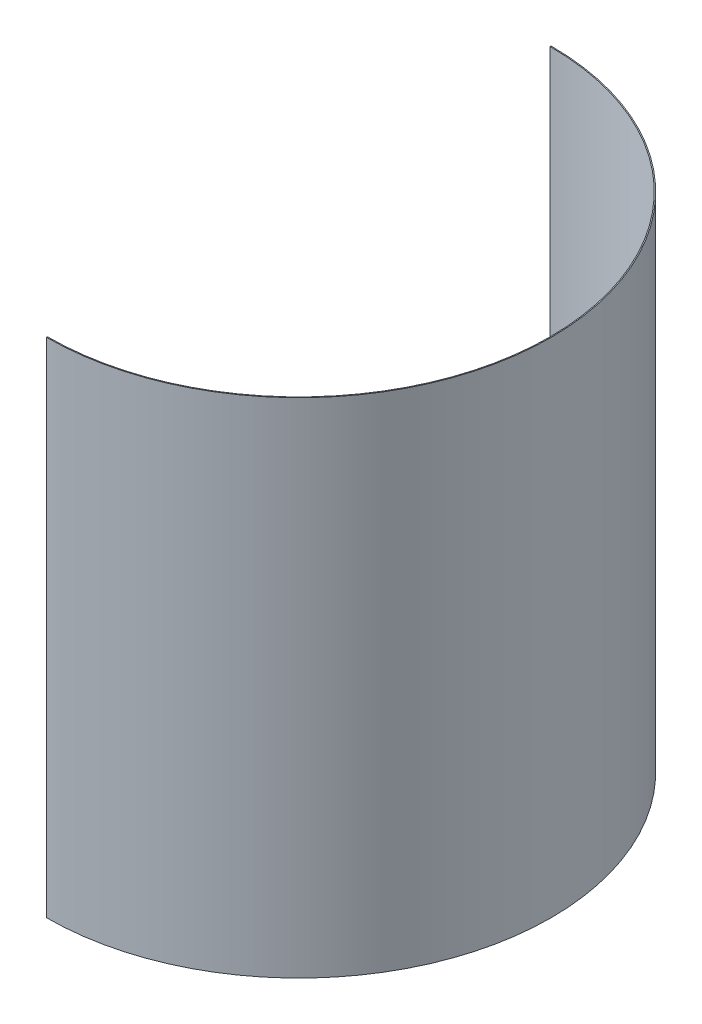
from build123d import *

# Parameters (mm, degrees)
SKETCH1_W          = 10000
SKETCH1_H          = 760
BASE_FLANGE1_DEPTH = 1.5
HEM2_START         = -380
HEM2_DEPTH         = 760
HEM2_2_DEPTH       = 760
SKETCH17_W         = 11222.895029189
SKETCH17_H         = 1018.315302658
CUT_EXTRUDE2_DEPTH = 5115.438605556


# Read off the part's stored shape, not the designer's step: Hem2
# Sheet-metal steps are written as plain solids
with BuildPart() as part:
    # Sketch1 → Base-Flange1 (new body)
    with BuildSketch(Plane.XY):
        Rectangle(SKETCH1_W, SKETCH1_H)
    extrude(amount=-BASE_FLANGE1_DEPTH)

    # Hem2 outline → Hem2 (cut)
    with BuildSketch(Plane(origin=(0, 0, 0), x_dir=(1, 0, 0), z_dir=(0, 1, 0)).offset(HEM2_START)):
        with BuildLine():
            ThreePointArc((4618.5, 1.5), (4635.415229824, 1.124815513), (4652.297189232, 0))
            Line((4652.297189232, 0), (5000, 0))
            Line((5000, 0), (5000, 1.5))
            Line((5000, 1.5), (4618.5, 1.5))
        make_face()
    extrude(amount=HEM2_DEPTH, mode=Mode.SUBTRACT)

    # Hem2 2 outline → Hem2 2 (add)
    with BuildSketch(Plane(origin=(0, 0, 0), x_dir=(1, 0, 0), z_dir=(0, 1, 0)).offset(HEM2_START)):
        with BuildLine():
            Line((4618.5, -760), (4618.5, -761.5))
            ThreePointArc((4618.5, -761.5), (4999.624815513, -396.915229824), (4652.297189232, 0))
            Line((4652.297189232, 0), (4618.5, 0))
            ThreePointArc((4618.5, 0), (4998.5, -380), (4618.5, -760))
        make_face()
    extrude(amount=HEM2_2_DEPTH)

    # Sketch17 → Cut-Extrude2 (cut, through all)
    with BuildSketch(Plane.XZ.offset(380)):
        with Locations((-992.947514595, -509.157651329)):
            Rectangle(SKETCH17_W, SKETCH17_H)
    extrude(amount=-CUT_EXTRUDE2_DEPTH, mode=Mode.SUBTRACT)


solid = part.part
